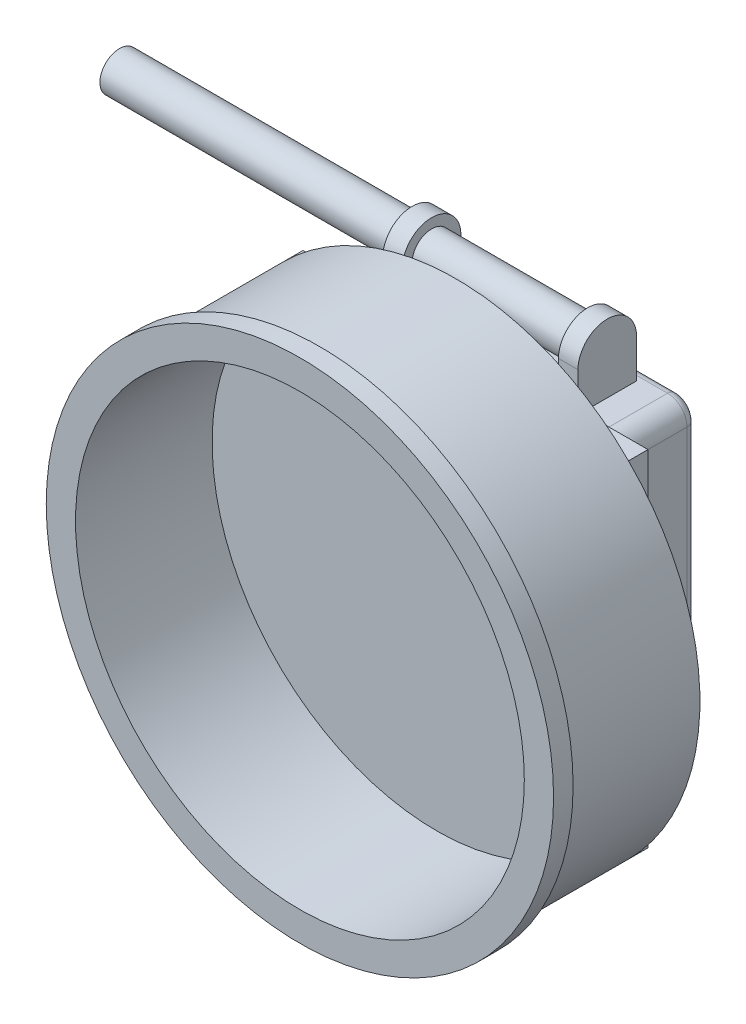
from build123d import *

# Parameters (mm, degrees)
LIGHT_SKETCH_R              = 125
LIGHT_EXTRUDE_DEPTH         = 80
LIGHT_SHELL_T               = -10
APERTURE_START              = -10
APERTURE_LIP_SKETCH_R       = 130
APERTURE_LIP_SKETCH_R_2     = 115
APERTURE_LIP_EXTRUDE_DEPTH  = 10
PLATE_SKETCH_W              = 176.776695296
PLATE_SKETCH_H              = 176.776695296
PLATE_EXTRUDE_DEPTH         = 10
ELECTRONICS_SKETCH_W        = 146.776695296
ELECTRONICS_SKETCH_H        = 166.776695296
ELECTRONICS_EXTRUDE_DEPTH   = 40
ELECTRONICS_BACK_FILLET_R   = 5
ELECTRONICS_SIDE_FILLET_R   = 10
HINGE_SUPPORT_EXTRUDE_DEPTH = 10
HINGE_POLE_SKETCH_R         = 10
HINGE_POLE_EXTRUDE_DEPTH    = 250


with BuildPart() as part:
    # Light Sketch → Light Extrude (new body)
    with BuildSketch(Plane.XY):
        Circle(LIGHT_SKETCH_R)
    extrude(amount=LIGHT_EXTRUDE_DEPTH)

    # Light Shell
    light_shell_openings = [part.faces().sort_by_distance(p)[0] for p in [
        (0, 0, 80),
    ]]
    offset(amount=LIGHT_SHELL_T, openings=light_shell_openings, kind=Kind.INTERSECTION)

    # Aperture Lip Sketch → Aperture Lip Extrude (add)
    with BuildSketch(Plane.XY.offset(80).offset(APERTURE_START)):
        Circle(APERTURE_LIP_SKETCH_R)
        Circle(APERTURE_LIP_SKETCH_R_2, mode=Mode.SUBTRACT)
    extrude(amount=APERTURE_LIP_EXTRUDE_DEPTH)

    # Plate Sketch → Plate Extrude (add)
    with BuildSketch(Plane(origin=(0, 0, 0), x_dir=(-1, 0, 0), z_dir=(0, 0, -1))):
        Rectangle(PLATE_SKETCH_W, PLATE_SKETCH_H)
    extrude(amount=PLATE_EXTRUDE_DEPTH)

    # Electronics Sketch → Electronics Extrude (add)
    with BuildSketch(Plane(origin=(0, 0, -10), x_dir=(-1, 0, 0), z_dir=(0, 0, -1))):
        Rectangle(ELECTRONICS_SKETCH_W, ELECTRONICS_SKETCH_H)
    extrude(amount=ELECTRONICS_EXTRUDE_DEPTH)

    # Electronics Back Fillet
    electronics_back_fillet_edges = [part.edges().sort_by_distance(p)[0] for p in [
        (73.388347648, 0, -50),
        (0, -83.388347648, -50),
        (-73.388347648, 0, -50),
        (0, 83.388347648, -50),
    ]]
    fillet(electronics_back_fillet_edges, radius=ELECTRONICS_BACK_FILLET_R)

    # Electronics Side Fillet
    # the kernel refuses this fillet: 10 mm, written as the material it takes off along each edge
    with BuildSketch(Plane(origin=(-63.388347648, -73.388347648, -50), x_dir=(0, -1, 0), z_dir=(1, 0, 0))) as electronics_side_fillet_piece_1:
        with BuildLine():
            CenterArc((5, -5), 5, 0, 90)
            Line((10, -5), (10, 0))
            Line((10, 0), (5, 0))
        make_face()
    revolve(axis=Axis((-63.388347648, -73.388347648, -50), (0, 0, -1)), revolution_arc=90, mode=Mode.SUBTRACT)
    with BuildSketch(Plane(origin=(63.388347648, -73.388347648, -50), x_dir=(1, 0, 0), z_dir=(0, 1, 0))) as electronics_side_fillet_piece_2:
        with BuildLine():
            CenterArc((5, -5), 5, 0, 90)
            Line((10, -5), (10, 0))
            Line((10, 0), (5, 0))
        make_face()
    revolve(axis=Axis((63.388347648, -73.388347648, -50), (0, 0, -1)), revolution_arc=90, mode=Mode.SUBTRACT)
    with BuildSketch(Plane(origin=(-63.388347648, 73.388347648, -50), x_dir=(-1, 0, 0), z_dir=(0, -1, 0))) as electronics_side_fillet_piece_3:
        with BuildLine():
            CenterArc((5, -5), 5, 0, 90)
            Line((10, -5), (10, 0))
            Line((10, 0), (5, 0))
        make_face()
    revolve(axis=Axis((-63.388347648, 73.388347648, -50), (0, 0, -1)), revolution_arc=90, mode=Mode.SUBTRACT)
    with BuildSketch(Plane(origin=(63.388347648, 73.388347648, -50), x_dir=(0, 1, 0), z_dir=(-1, 0, 0))) as electronics_side_fillet_piece_4:
        with BuildLine():
            CenterArc((5, -5), 5, 0, 90)
            Line((10, -5), (10, 0))
            Line((10, 0), (5, 0))
        make_face()
    revolve(axis=Axis((63.388347648, 73.388347648, -50), (0, 0, -1)), revolution_arc=90, mode=Mode.SUBTRACT)
    with BuildSketch(Plane(origin=(73.388347648, 83.388347648, -10), x_dir=(-1, 0, 0), z_dir=(0, 0, -1)), Plane(origin=(-73.388347648, 83.388347648, -10), x_dir=(0, -1, 0), z_dir=(0, 0, -1))) as electronics_side_fillet_piece_5:
        with BuildLine():
            CenterArc((ELECTRONICS_SIDE_FILLET_R, -ELECTRONICS_SIDE_FILLET_R), ELECTRONICS_SIDE_FILLET_R, 90, 90)
            Line((0, -ELECTRONICS_SIDE_FILLET_R), (0, 0))
            Line((0, 0), (ELECTRONICS_SIDE_FILLET_R, 0))
        make_face()
    extrude(amount=40, mode=Mode.SUBTRACT)
    with BuildSketch(Plane(origin=(-73.388347648, -83.388347648, -10), x_dir=(0, 1, 0), z_dir=(0, 0, -1)), Plane(origin=(73.388347648, -83.388347648, -10), x_dir=(-1, 0, 0), z_dir=(0, 0, -1))) as electronics_side_fillet_piece_6:
        with BuildLine():
            CenterArc((ELECTRONICS_SIDE_FILLET_R, ELECTRONICS_SIDE_FILLET_R), ELECTRONICS_SIDE_FILLET_R, 180, 90)
            Line((0, ELECTRONICS_SIDE_FILLET_R), (0, 0))
            Line((0, 0), (ELECTRONICS_SIDE_FILLET_R, 0))
        make_face()
    extrude(amount=40, mode=Mode.SUBTRACT)

    # Hinge Support Sketch → Hinge Support Extrude (add)
    with BuildSketch(Plane(origin=(40, 0, 0), x_dir=(0, 0, -1), z_dir=(1, 0, 0))):
        with BuildLine():
            Line((12.5, 103.388347648), (12.5, 83.388347648))
            Line((12.5, 83.388347648), (42.5, 83.388347648))
            Line((42.5, 83.388347648), (42.5, 103.388347648))
            ThreePointArc((42.5, 103.388347648), (27.5, 118.388347648), (12.5, 103.388347648))
        make_face()
    hinge_support_extrude = extrude(amount=HINGE_SUPPORT_EXTRUDE_DEPTH)

    # Hinge Support Mirror: Hinge Support Extrude across plane
    add(hinge_support_extrude.mirror(Plane(origin=(0, 0, 0), x_dir=(0, 0, 1), z_dir=(1, 0, 0))))

    # Hinge Pole Sketch → Hinge Pole Extrude (add)
    with BuildSketch(Plane(origin=(50, 0, 0), x_dir=(0, 0, -1), z_dir=(1, 0, 0))):
        with Locations((27.5, 103.388347648)):
            Circle(HINGE_POLE_SKETCH_R)
    extrude(amount=-HINGE_POLE_EXTRUDE_DEPTH)


solid = part.part
